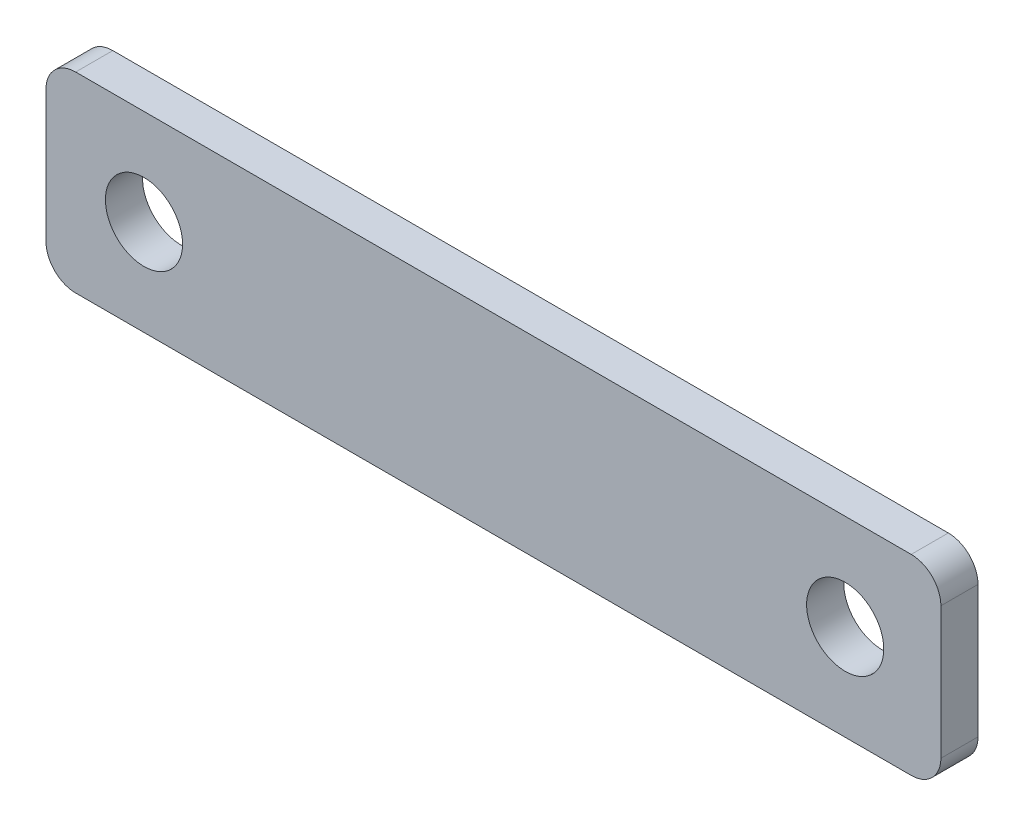
from build123d import *

# Parameters (mm, degrees)
SKETCH1_W            = 76.5658
SKETCH1_H            = 16.378
BASE_FLANGE1_DEPTH   = 3.175
M6_CLEARANCE_HOLE1_D = 6.6
FILLET1_R            = 2.54


# Sheet-metal steps are written as plain solids
with BuildPart() as part:
    # Sketch1 → Base-Flange1 (new body)
    with BuildSketch(Plane.XY):
        with Locations((15.489, -70.312600001)):
            Rectangle(SKETCH1_W, SKETCH1_H)
    extrude(amount=-BASE_FLANGE1_DEPTH)

    # M6 Clearance Hole1 (through all)
    with Locations(Plane.XY):
        with Locations((-14.4119, -70.312600001), (45.5829, -70.312600001)):
            Hole(M6_CLEARANCE_HOLE1_D / 2)

    # Fillet1
    fillet1_edges = [part.edges().sort_by_distance(p)[0] for p in [
        (-22.7939, -62.123600001, -1.5875),
        (53.7719, -62.123600001, -1.5875),
        (53.7719, -78.501600001, -1.5875),
        (-22.7939, -78.501600001, -1.5875),
    ]]
    fillet(fillet1_edges, radius=FILLET1_R)


solid = part.part
